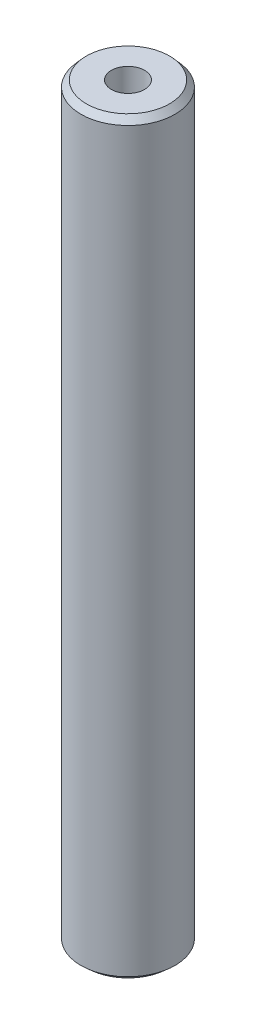
from build123d import *
from OCP.BRepFilletAPI import BRepFilletAPI_MakeChamfer

# Parameters (mm, degrees)
SKETCH1_R           = 25
BOSS_EXTRUDE1_DEPTH = 397.995592837
SKETCH2_R           = 8.826898409
CUT_EXTRUDE1_DEPTH  = 400.56287605
CHAMFER1_SIZE       = 3.32606828
CHAMFER1_SIZE2      = 2.934562301


with BuildPart() as part:
    # Sketch1 → Boss-Extrude1 (new body)
    with BuildSketch(Plane(origin=(0, 0, 0), x_dir=(1, 0, 0), z_dir=(0, 1, 0))):
        Circle(SKETCH1_R)
    extrude(amount=BOSS_EXTRUDE1_DEPTH)

    # Sketch2 → Cut-Extrude1 (cut, through all)
    with BuildSketch(Plane(origin=(0, 0, 0), x_dir=(1, 0, 0), z_dir=(0, 1, 0))):
        Circle(SKETCH2_R)
    extrude(amount=CUT_EXTRUDE1_DEPTH, mode=Mode.SUBTRACT)

    # Chamfer1: one chamfer whose edges measure the first distance from different faces: ONE call of the kernel's chamfer builder (chamfer() names one face for all edges)
    chamfer1_edges_1 = [part.edges().sort_by_distance(p)[0] for p in [
        (-25, 397.995592837, 0),
    ]]
    chamfer1_side_1 = [part.faces().sort_by_distance(p)[0] for p in [
        (-25, 198.997796418, 0),
    ]]
    chamfer1_edges_2 = [part.edges().sort_by_distance(p)[0] for p in [
        (-25, 0, 0),
    ]]
    chamfer1_side_2 = [part.faces().sort_by_distance(p)[0] for p in [
        (-24.292893219, 0, 0),
    ]]
    chamfer1 = BRepFilletAPI_MakeChamfer(part.part.solid().wrapped)
    for e in chamfer1_edges_1:
        chamfer1.Add(CHAMFER1_SIZE, CHAMFER1_SIZE2, e.wrapped, chamfer1_side_1[0].wrapped)  # the first distance lies on this face
    for e in chamfer1_edges_2:
        chamfer1.Add(CHAMFER1_SIZE, CHAMFER1_SIZE2, e.wrapped, chamfer1_side_2[0].wrapped)  # the first distance lies on this face
    add(Compound.cast(chamfer1.Shape()), mode=Mode.REPLACE)


solid = part.part
